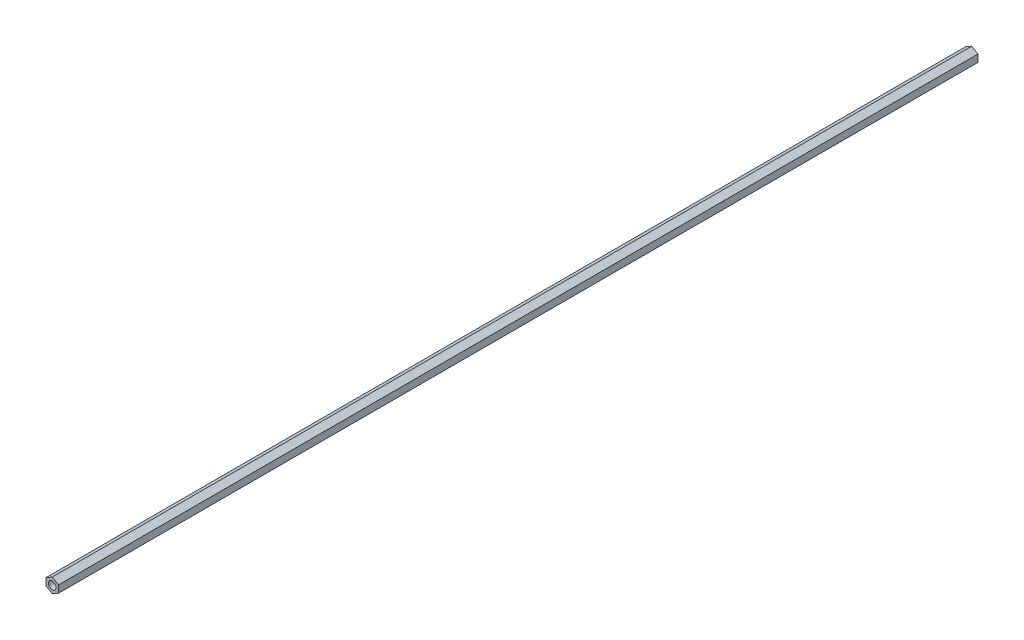
from build123d import *

# Parameters (mm, degrees)
BOSS_EXTRUDE1_DEPTH = 302.18126
SKETCH3_R           = 2.4892
CUT_EXTRUDE1_DEPTH  = 605.395357396


with BuildPart() as part:
    # Sketch2 → Boss-Extrude1 (new, symmetric)
    with BuildSketch(Plane.XY):
        Polygon((0, 4.7625), (-4.124445986, 2.38125), (-4.124445986, -2.38125), (0, -4.7625), (4.124445986, -2.38125), (4.124445986, 2.38125), align=None)
    extrude(amount=BOSS_EXTRUDE1_DEPTH, both=True)

    # Sketch3 → Cut-Extrude1 (cut, through all)
    with BuildSketch(Plane.XY.offset(302.18126)):
        Circle(SKETCH3_R)
    extrude(amount=-CUT_EXTRUDE1_DEPTH, mode=Mode.SUBTRACT)


solid = part.part
